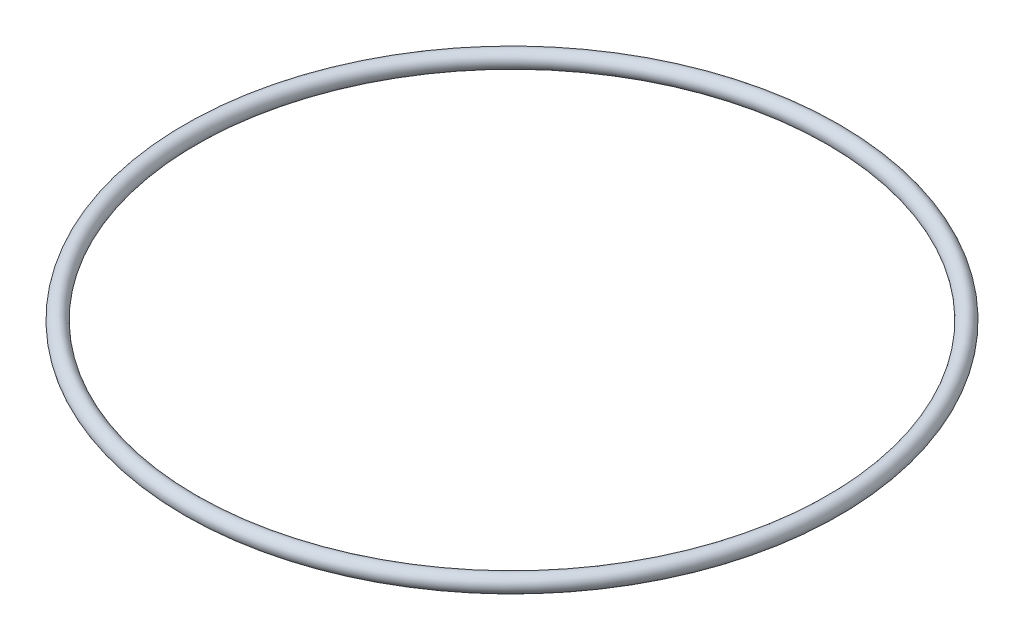
from build123d import *

# Parameters (mm, degrees)
SKETCH1_R = 1.25


with BuildPart() as part:
    # Sketch1 → Revolve1 (revolve)
    with BuildSketch(Plane.XY):
        with Locations((-48.87, 0)):
            Circle(SKETCH1_R)
    revolve(axis=Axis((0, 0, 0), (0, 1, 0)))


solid = part.part
